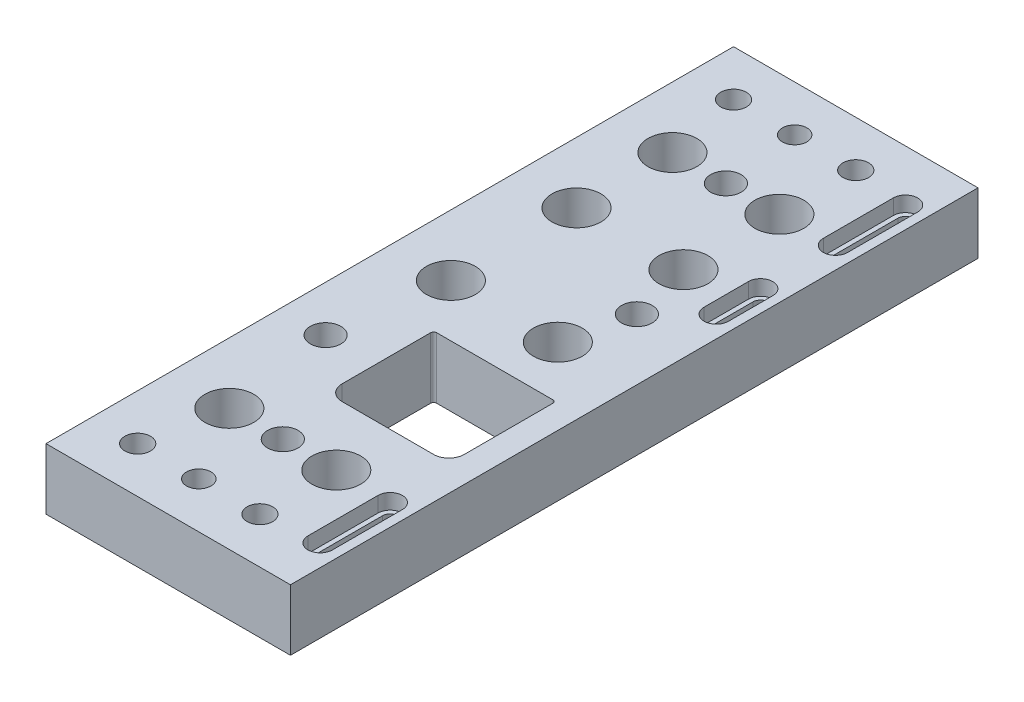
from build123d import *

# Parameters (mm, degrees)
SKETCH1_W                              = 80
SKETCH1_H                              = 225
BOSS_EXTRUDE1_DEPTH                    = 20
CUT_EXTRUDE1_REACH                     = 123.063
CUT_EXTRUDE2_REACH                     = 123.063
CUT_EXTRUDE3_DEPTH                     = 5
CBORE_FOR_M8_HEX_HEAD_BOLT1_AT_2_COUNT = 2
CBORE_FOR_M8_HEX_HEAD_BOLT1_AT_2_PITCH = 40
CBORE_FOR_M8_HEX_HEAD_BOLT1_AT_3_COUNT = 2
CBORE_FOR_M8_HEX_HEAD_BOLT1_AT_3_PITCH = 199.060292374
CBORE_FOR_M8_HEX_HEAD_BOLT1_AT_4_COUNT = 2
CBORE_FOR_M8_HEX_HEAD_BOLT1_AT_4_PITCH = 195
F_8_0MM_DOWEL_HOLE1_D                  = 8
F_8_0MM_DOWEL_HOLE1_CSINK_D            = 8.05
F_8_0MM_DOWEL_HOLE1_CSINK_ANGLE        = 90
CUT_EXTRUDE4_REACH                     = 123.063
SKETCH13_R                             = 8
CUT_EXTRUDE5_REACH                     = 123.063
SKETCH15_R                             = 5


with BuildPart() as part:
    # Sketch1 → Boss-Extrude1 (new body)
    with BuildSketch(Plane(origin=(0, 0, 0), x_dir=(1, 0, 0), z_dir=(0, 1, 0))):
        Rectangle(SKETCH1_W, SKETCH1_H)
    extrude(amount=-BOSS_EXTRUDE1_DEPTH)

    # Sketch2 → Cut-Extrude1 (cut, up to next)
    with BuildSketch(Plane(origin=(0, 0, 0), x_dir=(1, 0, 0), z_dir=(0, 1, 0)), mode=Mode.PRIVATE) as cut_extrude1_sk1:
        with BuildLine():
            Line((31.5, -47.14), (31.5, -18.14))
            ThreePointArc((31.5, -18.14), (31.207106781, -17.432893219), (30.5, -17.14))
            Line((30.5, -17.14), (-7.5, -17.14))
            ThreePointArc((-7.5, -17.14), (-8.207106781, -17.432893219), (-8.5, -18.14))
            Line((-8.5, -18.14), (-8.5, -47.14))
            ThreePointArc((-8.5, -47.14), (-7.035533906, -50.675533906), (-3.5, -52.14))
            Line((-3.5, -52.14), (26.5, -52.14))
            ThreePointArc((26.5, -52.14), (30.035533906, -50.675533906), (31.5, -47.14))
        make_face()
    cut_extrude1_tool1 = extrude(cut_extrude1_sk1.sketch, amount=-CUT_EXTRUDE1_REACH, mode=Mode.PRIVATE) & part.part
    add(cut_extrude1_tool1.solids().sort_by_distance((11.5, 0, 34.518764))[0], mode=Mode.SUBTRACT)

    # Sketch3 → Cut-Extrude2 (cut, up to next)
    with BuildSketch(Plane(origin=(0, 0, 0), x_dir=(1, 0, 0), z_dir=(0, 1, 0)), mode=Mode.PRIVATE) as cut_extrude2_sk1:
        with BuildLine():
            Line((35.5, -95.77), (35.5, -72.87))
            ThreePointArc((35.5, -72.87), (33, -70.37), (30.5, -72.87))
            Line((30.5, -72.87), (30.5, -95.77))
            ThreePointArc((30.5, -95.77), (33, -98.27), (35.5, -95.77))
        make_face()
    cut_extrude2_tool1 = extrude(cut_extrude2_sk1.sketch, amount=-CUT_EXTRUDE2_REACH, mode=Mode.PRIVATE) & part.part
    # Sketch3 → Cut-Extrude2 (cut, up to next)
    with BuildSketch(Plane(origin=(0, 0, 0), x_dir=(1, 0, 0), z_dir=(0, 1, 0)), mode=Mode.PRIVATE) as cut_extrude2_sk2:
        with BuildLine():
            Line((35.5, 33.86), (35.5, 48.36))
            ThreePointArc((35.5, 48.36), (33, 50.86), (30.5, 48.36))
            Line((30.5, 48.36), (30.5, 33.86))
            ThreePointArc((30.5, 33.86), (33, 31.36), (35.5, 33.86))
        make_face()
    cut_extrude2_tool2 = extrude(cut_extrude2_sk2.sketch, amount=-CUT_EXTRUDE2_REACH, mode=Mode.PRIVATE) & part.part
    # Sketch3 → Cut-Extrude2 (cut, up to next)
    with BuildSketch(Plane(origin=(0, 0, 0), x_dir=(1, 0, 0), z_dir=(0, 1, 0)), mode=Mode.PRIVATE) as cut_extrude2_sk3:
        with BuildLine():
            Line((35.5, 72.87), (35.5, 95.77))
            ThreePointArc((35.5, 95.77), (33, 98.27), (30.5, 95.77))
            Line((30.5, 95.77), (30.5, 72.87))
            ThreePointArc((30.5, 72.87), (33, 70.37), (35.5, 72.87))
        make_face()
    cut_extrude2_tool3 = extrude(cut_extrude2_sk3.sketch, amount=-CUT_EXTRUDE2_REACH, mode=Mode.PRIVATE) & part.part
    add(cut_extrude2_tool1.solids().sort_by_distance((33, 0, 84.32))[0], mode=Mode.SUBTRACT)
    add(cut_extrude2_tool2.solids().sort_by_distance((33, 0, -41.11))[0], mode=Mode.SUBTRACT)
    add(cut_extrude2_tool3.solids().sort_by_distance((33, 0, -84.32))[0], mode=Mode.SUBTRACT)

    # Sketch4 → Cut-Extrude3 (cut)
    with BuildSketch(Plane(origin=(0, 0, 0), x_dir=(1, 0, 0), z_dir=(0, 1, 0))):
        with BuildLine():
            Line((37, 72.87), (37, 95.77))
            ThreePointArc((37, 95.77), (33, 99.77), (29, 95.77))
            Line((29, 95.77), (29, 72.87))
            ThreePointArc((29, 72.87), (33, 68.87), (37, 72.87))
        make_face()
        with BuildLine():
            Line((37, 33.86), (37, 48.36))
            ThreePointArc((37, 48.36), (33, 52.36), (29, 48.36))
            Line((29, 48.36), (29, 33.86))
            ThreePointArc((29, 33.86), (33, 29.86), (37, 33.86))
        make_face()
        with BuildLine():
            Line((37, -95.77), (37, -72.87))
            ThreePointArc((37, -72.87), (33, -68.87), (29, -72.87))
            Line((29, -72.87), (29, -95.77))
            ThreePointArc((29, -95.77), (33, -99.77), (37, -95.77))
        make_face()
    extrude(amount=-CUT_EXTRUDE3_DEPTH, mode=Mode.SUBTRACT)

    # Sketch8 → CBORE for M8 Hex Head Bolt1 (revolve, cut)
    with BuildSketch(Plane(origin=(-25, -20, -97.5), x_dir=(0, 0, -1), z_dir=(1, 0, 0))):
        Polygon((0, 0), (0, 20), (4.2, 20), (4.2, 5.3), (9.0055, 5.3), (9.0055, 0.025), (9.0305, 0), align=None)
    cbore_for_m8_hex_head_bolt1 = revolve(axis=Axis((-25, -26.35, -97.5), (0, 1, 0)), mode=Mode.SUBTRACT)

    # CBORE for M8 Hex Head Bolt1 at 2: CBORE for M8 Hex Head Bolt1 ×2
    with Locations(*[(i * CBORE_FOR_M8_HEX_HEAD_BOLT1_AT_2_PITCH, 0, 0) for i in range(1, CBORE_FOR_M8_HEX_HEAD_BOLT1_AT_2_COUNT)]):
        add(cbore_for_m8_hex_head_bolt1, mode=Mode.SUBTRACT)

    # CBORE for M8 Hex Head Bolt1 at 3: CBORE for M8 Hex Head Bolt1 ×2
    with Locations(*[Vector(0.2009441437213313, 0, 0.9796027006414901) * (i * CBORE_FOR_M8_HEX_HEAD_BOLT1_AT_3_PITCH) for i in range(1, CBORE_FOR_M8_HEX_HEAD_BOLT1_AT_3_COUNT)]):
        add(cbore_for_m8_hex_head_bolt1, mode=Mode.SUBTRACT)

    # CBORE for M8 Hex Head Bolt1 at 4: CBORE for M8 Hex Head Bolt1 ×2
    with Locations(*[(0, 0, i * CBORE_FOR_M8_HEX_HEAD_BOLT1_AT_4_PITCH) for i in range(1, CBORE_FOR_M8_HEX_HEAD_BOLT1_AT_4_COUNT)]):
        add(cbore_for_m8_hex_head_bolt1, mode=Mode.SUBTRACT)

    # Ø8.0mm Dowel Hole1 (through all)
    with Locations(Plane(origin=(0, -20, 0), x_dir=(-1, 0, 0), z_dir=(0, -1, 0))):
        with Locations((5, -97.5), (5, 97.5)):
            CounterSinkHole(F_8_0MM_DOWEL_HOLE1_D / 2, F_8_0MM_DOWEL_HOLE1_CSINK_D / 2, counter_sink_angle=F_8_0MM_DOWEL_HOLE1_CSINK_ANGLE)

    # Sketch13 → Cut-Extrude4 (cut, up to next)
    with BuildSketch(Plane(origin=(0, 0, 0), x_dir=(1, 0, 0), z_dir=(0, 1, 0)), mode=Mode.PRIVATE) as cut_extrude4_sk1:
        with Locations((15, 41.11)):
            Circle(SKETCH13_R)
    cut_extrude4_tool1 = extrude(cut_extrude4_sk1.sketch, amount=-CUT_EXTRUDE4_REACH, mode=Mode.PRIVATE) & part.part
    # Sketch13 → Cut-Extrude4 (cut, up to next)
    with BuildSketch(Plane(origin=(0, 0, 0), x_dir=(1, 0, 0), z_dir=(0, 1, 0)), mode=Mode.PRIVATE) as cut_extrude4_sk2:
        with Locations((15, 0)):
            Circle(SKETCH13_R)
    cut_extrude4_tool2 = extrude(cut_extrude4_sk2.sketch, amount=-CUT_EXTRUDE4_REACH, mode=Mode.PRIVATE) & part.part
    # Sketch13 → Cut-Extrude4 (cut, up to next)
    with BuildSketch(Plane(origin=(0, 0, 0), x_dir=(1, 0, 0), z_dir=(0, 1, 0)), mode=Mode.PRIVATE) as cut_extrude4_sk3:
        with Locations((15, -72.5)):
            Circle(SKETCH13_R)
    cut_extrude4_tool3 = extrude(cut_extrude4_sk3.sketch, amount=-CUT_EXTRUDE4_REACH, mode=Mode.PRIVATE) & part.part
    # Sketch13 → Cut-Extrude4 (cut, up to next)
    with BuildSketch(Plane(origin=(0, 0, 0), x_dir=(1, 0, 0), z_dir=(0, 1, 0)), mode=Mode.PRIVATE) as cut_extrude4_sk4:
        with Locations((-20, -72.5)):
            Circle(SKETCH13_R)
    cut_extrude4_tool4 = extrude(cut_extrude4_sk4.sketch, amount=-CUT_EXTRUDE4_REACH, mode=Mode.PRIVATE) & part.part
    # Sketch13 → Cut-Extrude4 (cut, up to next)
    with BuildSketch(Plane(origin=(0, 0, 0), x_dir=(1, 0, 0), z_dir=(0, 1, 0)), mode=Mode.PRIVATE) as cut_extrude4_sk5:
        with Locations((-20, 0)):
            Circle(SKETCH13_R)
    cut_extrude4_tool5 = extrude(cut_extrude4_sk5.sketch, amount=-CUT_EXTRUDE4_REACH, mode=Mode.PRIVATE) & part.part
    # Sketch13 → Cut-Extrude4 (cut, up to next)
    with BuildSketch(Plane(origin=(0, 0, 0), x_dir=(1, 0, 0), z_dir=(0, 1, 0)), mode=Mode.PRIVATE) as cut_extrude4_sk6:
        with Locations((-20, 41.11)):
            Circle(SKETCH13_R)
    cut_extrude4_tool6 = extrude(cut_extrude4_sk6.sketch, amount=-CUT_EXTRUDE4_REACH, mode=Mode.PRIVATE) & part.part
    # Sketch13 → Cut-Extrude4 (cut, up to next)
    with BuildSketch(Plane(origin=(0, 0, 0), x_dir=(1, 0, 0), z_dir=(0, 1, 0)), mode=Mode.PRIVATE) as cut_extrude4_sk7:
        with Locations((-20, 72.5)):
            Circle(SKETCH13_R)
    cut_extrude4_tool7 = extrude(cut_extrude4_sk7.sketch, amount=-CUT_EXTRUDE4_REACH, mode=Mode.PRIVATE) & part.part
    # Sketch13 → Cut-Extrude4 (cut, up to next)
    with BuildSketch(Plane(origin=(0, 0, 0), x_dir=(1, 0, 0), z_dir=(0, 1, 0)), mode=Mode.PRIVATE) as cut_extrude4_sk8:
        with Locations((15, 72.5)):
            Circle(SKETCH13_R)
    cut_extrude4_tool8 = extrude(cut_extrude4_sk8.sketch, amount=-CUT_EXTRUDE4_REACH, mode=Mode.PRIVATE) & part.part
    add(cut_extrude4_tool1.solids().sort_by_distance((15, 0, -41.11))[0], mode=Mode.SUBTRACT)
    add(cut_extrude4_tool2.solids().sort_by_distance((15, 0, 0))[0], mode=Mode.SUBTRACT)
    add(cut_extrude4_tool3.solids().sort_by_distance((15, 0, 72.5))[0], mode=Mode.SUBTRACT)
    add(cut_extrude4_tool4.solids().sort_by_distance((-20, 0, 72.5))[0], mode=Mode.SUBTRACT)
    add(cut_extrude4_tool5.solids().sort_by_distance((-20, 0, 0))[0], mode=Mode.SUBTRACT)
    add(cut_extrude4_tool6.solids().sort_by_distance((-20, 0, -41.11))[0], mode=Mode.SUBTRACT)
    add(cut_extrude4_tool7.solids().sort_by_distance((-20, 0, -72.5))[0], mode=Mode.SUBTRACT)
    add(cut_extrude4_tool8.solids().sort_by_distance((15, 0, -72.5))[0], mode=Mode.SUBTRACT)

    # Sketch15 → Cut-Extrude5 (cut, up to next)
    with BuildSketch(Plane(origin=(0, 0, 0), x_dir=(1, 0, 0), z_dir=(0, 1, 0)), mode=Mode.PRIVATE) as cut_extrude5_sk1:
        with Locations((-2.5, -72.5)):
            Circle(SKETCH15_R)
    cut_extrude5_tool1 = extrude(cut_extrude5_sk1.sketch, amount=-CUT_EXTRUDE5_REACH, mode=Mode.PRIVATE) & part.part
    # Sketch15 → Cut-Extrude5 (cut, up to next)
    with BuildSketch(Plane(origin=(0, 0, 0), x_dir=(1, 0, 0), z_dir=(0, 1, 0)), mode=Mode.PRIVATE) as cut_extrude5_sk2:
        with Locations((-25, -36)):
            Circle(SKETCH15_R)
    cut_extrude5_tool2 = extrude(cut_extrude5_sk2.sketch, amount=-CUT_EXTRUDE5_REACH, mode=Mode.PRIVATE) & part.part
    # Sketch15 → Cut-Extrude5 (cut, up to next)
    with BuildSketch(Plane(origin=(0, 0, 0), x_dir=(1, 0, 0), z_dir=(0, 1, 0)), mode=Mode.PRIVATE) as cut_extrude5_sk3:
        with Locations((20, 20.863945448)):
            Circle(SKETCH15_R)
    cut_extrude5_tool3 = extrude(cut_extrude5_sk3.sketch, amount=-CUT_EXTRUDE5_REACH, mode=Mode.PRIVATE) & part.part
    # Sketch15 → Cut-Extrude5 (cut, up to next)
    with BuildSketch(Plane(origin=(0, 0, 0), x_dir=(1, 0, 0), z_dir=(0, 1, 0)), mode=Mode.PRIVATE) as cut_extrude5_sk4:
        with Locations((-2.5, 72.5)):
            Circle(SKETCH15_R)
    cut_extrude5_tool4 = extrude(cut_extrude5_sk4.sketch, amount=-CUT_EXTRUDE5_REACH, mode=Mode.PRIVATE) & part.part
    add(cut_extrude5_tool1.solids().sort_by_distance((-2.5, 0, 72.5))[0], mode=Mode.SUBTRACT)
    add(cut_extrude5_tool2.solids().sort_by_distance((-25, 0, 36))[0], mode=Mode.SUBTRACT)
    add(cut_extrude5_tool3.solids().sort_by_distance((20, 0, -20.863945))[0], mode=Mode.SUBTRACT)
    add(cut_extrude5_tool4.solids().sort_by_distance((-2.5, 0, -72.5))[0], mode=Mode.SUBTRACT)


solid = part.part
